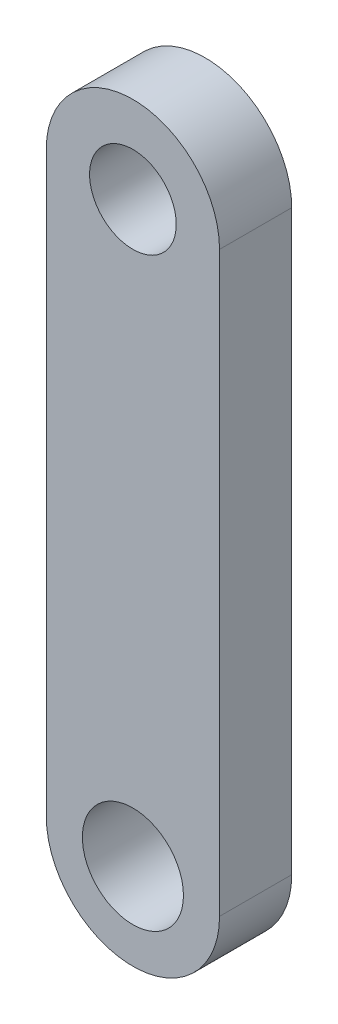
from build123d import *

# Parameters (mm, degrees)
DODANIE_WYCI_GNI_CIE1_DEPTH = 5


with BuildPart() as part:
    # Szkic1 → Dodanie-wyciągnięcie1 (new body)
    with BuildSketch(Plane.XY):
        with BuildLine():
            Line((-6, 0), (-6, -40))
            ThreePointArc((-6, -40), (0, -46), (6, -40))
            Line((6, -40), (6, 0))
            ThreePointArc((6, 0), (0, 6), (-6, 0))
        make_face()
        with BuildLine():
            ThreePointArc((3.5, -40), (-2.474873734, -42.474873734), (0, -36.5))
            ThreePointArc((0, -36.5), (2.474873734, -37.525126266), (3.5, -40))
        make_face(mode=Mode.SUBTRACT)
        with BuildLine():
            ThreePointArc((3, 0), (2.121320344, -2.121320344), (0, -3))
            ThreePointArc((0, -3), (-2.121320344, 2.121320344), (3, 0))
        make_face(mode=Mode.SUBTRACT)
    extrude(amount=DODANIE_WYCI_GNI_CIE1_DEPTH)


solid = part.part
